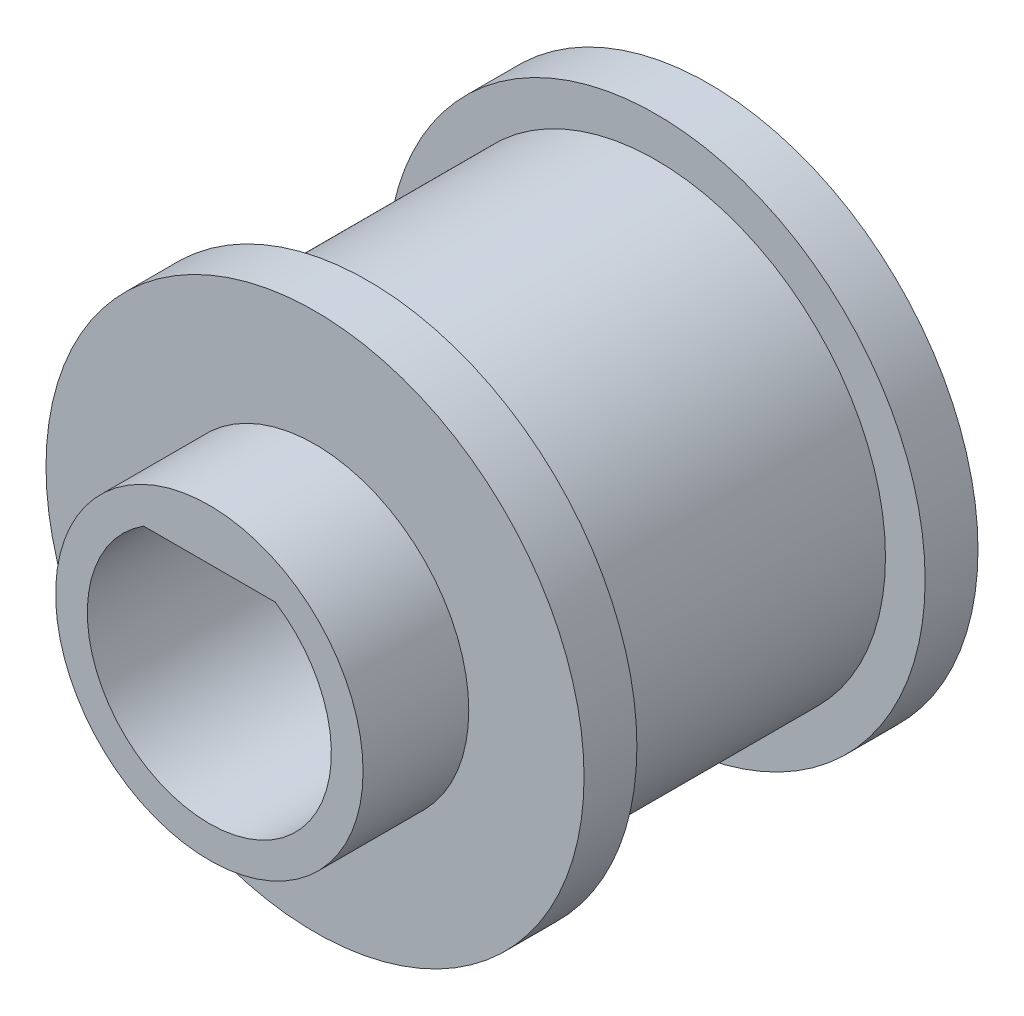
from build123d import *

# Parameters (mm, degrees)
SZKIC1_R                    = 11.935
DODANIE_WYCI_GNI_CIE1_DEPTH = 20.5
SZKIC2_R                    = 8
DODANIE_WYCI_GNI_CIE2_DEPTH = 5.5
SZKIC3_R                    = 14
DODANIE_WYCI_GNI_CIE3_DEPTH = 2.75
SZYK_LINIOWY1_COUNT         = 2
SZYK_LINIOWY1_PITCH         = 17.75
SZKIC6_R                    = 6.35
WYTNIJ_WYCI_GNI_CIE1_DEPTH  = 26
SZKIC7_W                    = 7.160111465
SZKIC7_H                    = 1
DODANIE_WYCI_GNI_CIE4_DEPTH = 26


with BuildPart() as part:
    # Szkic1 → Dodanie-wyciągnięcie1 (new body)
    with BuildSketch(Plane.XY):
        Circle(SZKIC1_R)
    extrude(amount=DODANIE_WYCI_GNI_CIE1_DEPTH)

    # Szkic2 → Dodanie-wyciągnięcie2 (add)
    with BuildSketch(Plane.XY.offset(20.5)):
        Circle(SZKIC2_R)
    extrude(amount=DODANIE_WYCI_GNI_CIE2_DEPTH)

    # Szkic3 → Dodanie-wyciągnięcie3 (add)
    with BuildSketch(Plane.XY.offset(20.5)):
        Circle(SZKIC3_R)
    dodanie_wyci_gni_cie3 = extrude(amount=-DODANIE_WYCI_GNI_CIE3_DEPTH)

    # Szyk liniowy1: Dodanie-wyciągnięcie3 ×2
    with Locations(*[(0, 0, -i * SZYK_LINIOWY1_PITCH) for i in range(1, SZYK_LINIOWY1_COUNT)]):
        add(dodanie_wyci_gni_cie3)

    # Szkic6 → Wytnij-wyciągnięcie1 (cut)
    with BuildSketch(Plane.XY.offset(26)):
        Circle(SZKIC6_R)
    extrude(amount=-WYTNIJ_WYCI_GNI_CIE1_DEPTH, mode=Mode.SUBTRACT)

    # Szkic7 → Dodanie-wyciągnięcie4 (add)
    with BuildSketch(Plane.XY.offset(26)):
        with Locations((-0.011261518, 5.85)):
            Rectangle(SZKIC7_W, SZKIC7_H)
    extrude(amount=-DODANIE_WYCI_GNI_CIE4_DEPTH)


solid = part.part
